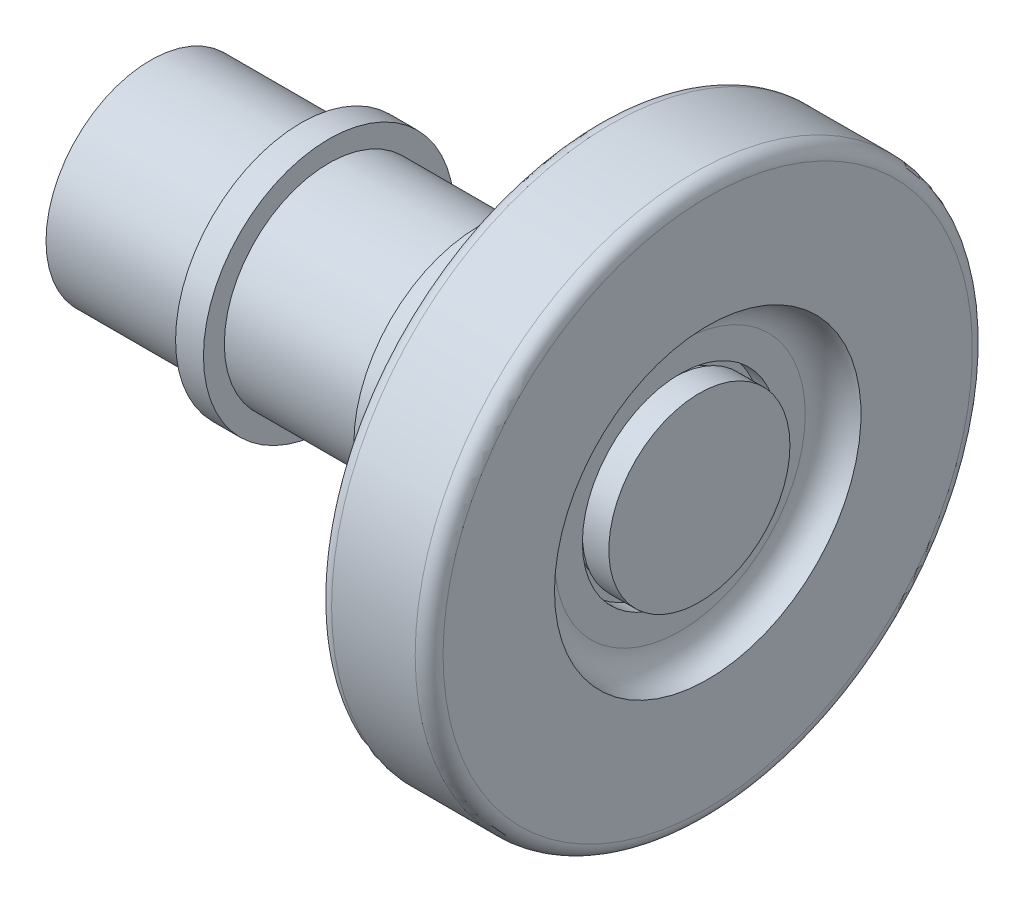
from build123d import *

# Parameters (mm, degrees)
FILLET_1_R      = 5
FILLET_2_R      = 10
SKETCH_2_R      = 45
SKETCH_2_R_2    = 35
EXTRUDE_1_DEPTH = 32
SKETCH_3_R      = 35
EXTRUDE_2_DEPTH = 66
SKETCH_4_R      = 37.5
EXTRUDE_3_DEPTH = 54
SKETCH_5_R      = 45
EXTRUDE_4_DEPTH = 10
SKETCH_6_R      = 37.5
EXTRUDE_5_DEPTH = 54
SKETCH_9_R      = 31
EXTRUDE_8_DEPTH = 3.5
SKETCH_10_R     = 32.5
EXTRUDE_9_DEPTH = 9.5


with BuildPart() as part:
    # 草图1 → 旋转1 (revolve)
    with BuildSketch(Plane.XY, mode=Mode.PRIVATE) as revolve_1_sk:
        Polygon((10, 100), (50, 100), (50, 55), (40, 55), (40, 35), (0, 35), (0, 70), (10, 70), align=None)
    revolve(revolve_1_sk.sketch.rotate(Axis((-1000, 0, 0), (1, 0, 0)), 90), axis=Axis((-1000, 0, 0), (1, 0, 0)))

    # 圆角1
    fillet_1_edges = [part.edges().sort_by_distance(p)[0] for p in [
        (10, 0, -70),
        (50, 0, -100),
        (10, 0, -100),
    ]]
    fillet(fillet_1_edges, radius=FILLET_1_R)

    # 圆角2
    fillet_2_edges = [part.edges().sort_by_distance(p)[0] for p in [
        (40, 0, -55),
    ]]
    fillet(fillet_2_edges, radius=FILLET_2_R - 0.0001)  # a hair under: the kernel refuses the full size



with BuildPart() as body_2:
    # 草图2 → 凸台-拉伸1 (new body)
    with BuildSketch(Plane.ZY):
        Circle(SKETCH_2_R)
        Circle(SKETCH_2_R_2, mode=Mode.SUBTRACT)
    extrude(amount=EXTRUDE_1_DEPTH)


with BuildPart() as part_1:
    add(part.part)

    add(body_2.part)  # 凸台-拉伸2 merges body 2
    # 草图3 → 凸台-拉伸2 (add)
    with BuildSketch(Plane.ZY.offset(32)):
        Circle(SKETCH_3_R)
    extrude(amount=-EXTRUDE_2_DEPTH)

    # 草图4 → 凸台-拉伸3 (add)
    with BuildSketch(Plane.ZY.offset(32)):
        Circle(SKETCH_4_R)
    extrude(amount=EXTRUDE_3_DEPTH)

    # 草图5 → 凸台-拉伸4 (add)
    with BuildSketch(Plane.ZY.offset(86)):
        with Locations(Location((0, 0, 0), (0, 0, 180))):
            Circle(SKETCH_5_R)
    extrude(amount=EXTRUDE_4_DEPTH)

    # 草图6 → 凸台-拉伸5 (add)
    with BuildSketch(Plane.ZY.offset(96)):
        Circle(SKETCH_6_R)
    extrude(amount=EXTRUDE_5_DEPTH)

    # 草图9 → 凸台-拉伸8 (add)
    with BuildSketch(Plane(origin=(34, 0, 0), x_dir=(0, 0, -1), z_dir=(1, 0, 0))):
        with Locations(Location((0, 0, 0), (0, 0, 180))):
            Circle(SKETCH_9_R)
    extrude(amount=EXTRUDE_8_DEPTH)

    # 草图10 → 凸台-拉伸9 (add)
    with BuildSketch(Plane(origin=(37.5, 0, 0), x_dir=(0, 0, -1), z_dir=(1, 0, 0))):
        Circle(SKETCH_10_R)
    extrude(amount=EXTRUDE_9_DEPTH)


solid = part_1.part
